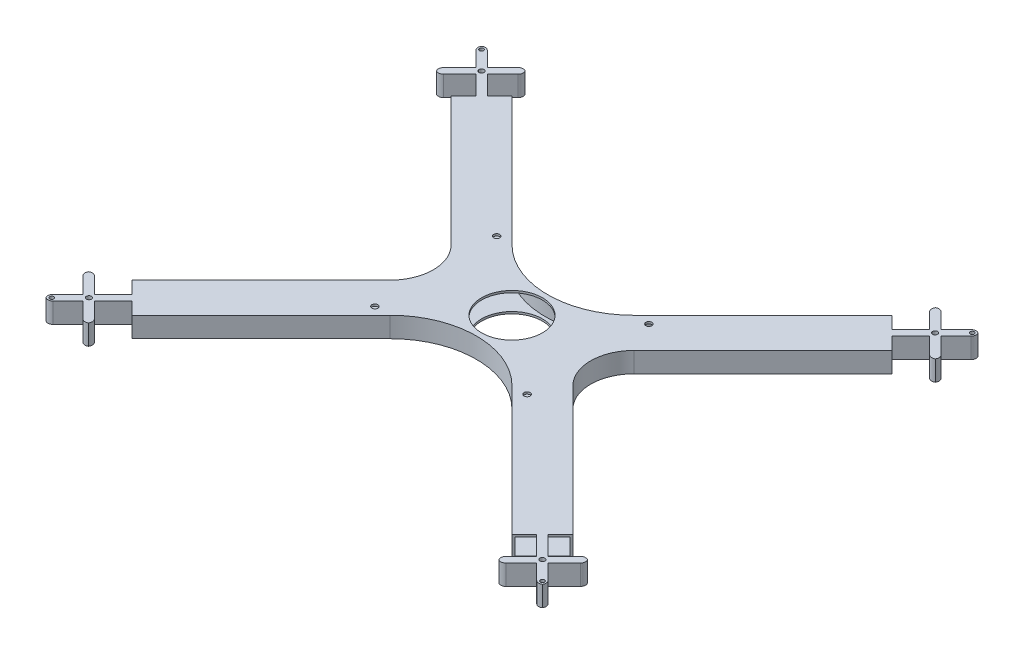
from build123d import *

# Parameters (mm, degrees)
Y_KSEKLIK_EKSTR_ZYON1_DEPTH = 10
IZIM5_W                     = 42.426406871
IZIM5_H                     = 20
Y_KSEKLIK_EKSTR_ZYON2_DEPTH = 180
AYNALAMA2_COPY_1_SKETCH_W   = 42.426406871
AYNALAMA2_COPY_1_SKETCH_H   = 20
AYNALAMA2_COPY_1_DEPTH      = 180
BO_ALTMA3_T                 = -2
IZIM10_R                    = 30
KES_EKSTR_ZYON4_DEPTH       = 52
IZIM11_R                    = 3
KES_EKSTR_ZYON5_DEPTH       = 52
IZIM12_W                    = 8
IZIM12_H                    = 20
Y_KSEKLIK_EKSTR_ZYON3_DEPTH = 60
IZIM14_W                    = 8
IZIM14_H                    = 20
Y_KSEKLIK_EKSTR_ZYON4_DEPTH = 27.5
IZIM15_R                    = 2.5
KES_EKSTR_ZYON6_DEPTH       = 52
IZIM16_W                    = 8
IZIM16_H                    = 20
Y_KSEKLIK_EKSTR_ZYON5_DEPTH = 7
RADYUS2_R                   = 5
IZIM17_R                    = 2
KES_EKSTR_ZYON7_DEPTH       = 31
RADYUS2_OF_AYNALAMA3_R      = 5
AYNALAMA4_START             = -10
AYNALAMA4_OUTLINE_R         = 2
AYNALAMA4_OUTLINE_R_2       = 2.5
AYNALAMA4_DEPTH             = 20


# Read off the part's stored shape, not the designer's step: Aynalama4
with BuildPart() as part:
    # Çizim1 → Yükseklik-Ekstrüzyon1 (new, symmetric)
    with BuildSketch(Plane(origin=(0, 0, 0), x_dir=(1, 0, 0), z_dir=(0, 1, 0))):
        with BuildLine():
            ThreePointArc((90, 30), (77.573593129, 0), (90, -30))
            Line((90, -30), (60, -60))
            ThreePointArc((60, -60), (0, -35.147186258), (-60, -60))
            Line((-60, -60), (-90, -30))
            ThreePointArc((-90, -30), (-77.573593129, 0), (-90, 30))
            Line((-90, 30), (-60, 60))
            ThreePointArc((-60, 60), (0, 35.147186258), (60, 60))
            Line((60, 60), (90, 30))
        make_face()
    extrude(amount=Y_KSEKLIK_EKSTR_ZYON1_DEPTH, both=True)

    # Çizim5 → Yükseklik-Ekstrüzyon2 (add)
    with BuildSketch(Plane(origin=(60, 0, 60), x_dir=(0.7071067811865477, 0, -0.7071067811865474), z_dir=(0.7071067811865474, 0, 0.7071067811865477))):
        with Locations((21.213203436, 0)):
            Rectangle(IZIM5_W, IZIM5_H)
    y_kseklik_ekstr_zyon2 = extrude(amount=Y_KSEKLIK_EKSTR_ZYON2_DEPTH)

    # Aynalama1: Yükseklik-Ekstrüzyon2 across plane
    add(y_kseklik_ekstr_zyon2.mirror(Plane.XY))

    # Aynalama2: Yükseklik-Ekstrüzyon2 across plane
    add(y_kseklik_ekstr_zyon2.mirror(Plane(origin=(0, 0, 0), x_dir=(0, 0, 1), z_dir=(1, 0, 0))))

    # Aynalama2 copy 1 sketch → Aynalama2 copy 1 (add)
    with BuildSketch(Plane(origin=(-60, 0, -60), x_dir=(-0.7071067811865477, 0, 0.7071067811865474), z_dir=(-0.7071067811865474, 0, -0.7071067811865477))):
        with Locations((21.213203436, 0)):
            Rectangle(AYNALAMA2_COPY_1_SKETCH_W, AYNALAMA2_COPY_1_SKETCH_H)
    extrude(amount=AYNALAMA2_COPY_1_DEPTH)

    # İç Boşaltma3
    bo_altma3_openings = [part.faces().sort_by_distance(p)[0] for p in [
        (202.279220614, 0, 172.279220614),
    ]]
    offset(amount=BO_ALTMA3_T, openings=bo_altma3_openings, kind=Kind.INTERSECTION)

    # Çizim10 → Kes-Ekstrüzyon4 (cut)
    with BuildSketch(Plane(origin=(0, 10, 0), x_dir=(1, 0, 0), z_dir=(0, 1, 0))):
        with Locations(Location((0, 0, 0), (0, 0, 270))):
            Circle(IZIM10_R)
    extrude(amount=-KES_EKSTR_ZYON4_DEPTH, mode=Mode.SUBTRACT)

    # Çizim11 → Kes-Ekstrüzyon5 (cut)
    with BuildSketch(Plane(origin=(0, 10, 0), x_dir=(1, 0, 0), z_dir=(0, 1, 0))):
        with Locations(Location((74.889148593, 60, 0), (0, 0, 270))):
            Circle(IZIM11_R)
        with Locations(Location((74.889148593, -60, 0), (0, 0, 270))):
            Circle(IZIM11_R)
        with Locations(Location((-75.110851407, -60, 0), (0, 0, 270))):
            Circle(IZIM11_R)
        with Locations(Location((-75.110851407, 60, 0), (0, 0, 270))):
            Circle(IZIM11_R)
    extrude(amount=-KES_EKSTR_ZYON5_DEPTH, mode=Mode.SUBTRACT)

    # Çizim12 → Yükseklik-Ekstrüzyon3 (add)
    with BuildSketch(Plane(origin=(187.279220614, 0, -187.279220614), x_dir=(-0.7071067811865477, 0, -0.7071067811865474), z_dir=(0.7071067811865474, 0, -0.7071067811865477))):
        with Locations((-21.213203436, 0)):
            Rectangle(IZIM12_W, IZIM12_H)
    y_kseklik_ekstr_zyon3 = extrude(amount=Y_KSEKLIK_EKSTR_ZYON3_DEPTH)

    # Çizim14 → Yükseklik-Ekstrüzyon4 (add, symmetric)
    with BuildSketch(Plane(origin=(17.828427125, 0, 17.828427125), x_dir=(0.7071067811865475, 0, -0.7071067811865477), z_dir=(0.7071067811865477, 0, 0.7071067811865475))):
        with Locations((295.042813742, 0)):
            Rectangle(IZIM14_W, IZIM14_H)
    y_kseklik_ekstr_zyon4 = extrude(amount=Y_KSEKLIK_EKSTR_ZYON4_DEPTH, both=True)

    # Çizim15 → Kes-Ekstrüzyon6 (cut)
    with BuildSketch(Plane(origin=(0, 10, 0), x_dir=(1, 0, 0), z_dir=(0, 1, 0))):
        with Locations(Location((223.492424049, 193.492424049, 0), (0, 0, 270))):
            Circle(IZIM15_R)
    kes_ekstr_zyon6 = extrude(amount=-KES_EKSTR_ZYON6_DEPTH, mode=Mode.SUBTRACT)

    # Çizim16 → Yükseklik-Ekstrüzyon5 (add)
    with BuildSketch(Plane(origin=(-1.617009358, 0, -1.617009358), x_dir=(-0.7071067811865475, 0, 0.7071067811865477), z_dir=(-0.7071067811865477, 0, -0.7071067811865475))):
        with Locations((-295.042813742, 0)):
            Rectangle(IZIM16_W, IZIM16_H)
    y_kseklik_ekstr_zyon5 = extrude(amount=Y_KSEKLIK_EKSTR_ZYON5_DEPTH)

    # Radyus2
    # the kernel refuses this fillet: 5 mm, written as the material it takes off along each edge
    with BuildSketch(Plane(origin=(243.07221082, -22.5, -168.524483605), x_dir=(-0.7071067811865446, 0, -0.7071067811865503), z_dir=(0, 1, 0)), Plane(origin=(204.888444636, -22.5, -218.021958289), x_dir=(0.7071067811865503, 0, 0.7071067811865446), z_dir=(0, 1, 0)), Plane(origin=(241.87720036, -22.5, -217.53405461), x_dir=(0.7071067811865476, 0, 0.7071067811865476), z_dir=(0, 1, 0))) as radyus2_piece_1:
        with BuildLine():
            CenterArc((RADYUS2_R, -RADYUS2_R), RADYUS2_R, 90, 90)
            Line((0, -RADYUS2_R), (0, 0))
            Line((0, 0), (RADYUS2_R, 0))
        make_face()
    extrude(amount=45, mode=Mode.SUBTRACT)
    with BuildSketch(Plane(origin=(248.72906507, 22.5, -174.181337855), x_dir=(-0.7071067811865476, 0, 0.7071067811865476), z_dir=(0, -1, 0)), Plane(origin=(199.231590387, 22.5, -212.365104039), x_dir=(0.7071067811865476, 0, -0.7071067811865476), z_dir=(0, -1, 0)), Plane(origin=(247.53405461, 22.5, -211.87720036), x_dir=(-0.7071067811865532, 0, 0.7071067811865419), z_dir=(0, -1, 0))) as radyus2_piece_2:
        with BuildLine():
            CenterArc((RADYUS2_R, RADYUS2_R), RADYUS2_R, 180, 90)
            Line((0, RADYUS2_R), (0, 0))
            Line((0, 0), (RADYUS2_R, 0))
        make_face()
    extrude(amount=45, mode=Mode.SUBTRACT)

    # Çizim17 → Kes-Ekstrüzyon7 (cut)
    with BuildSketch(Plane(origin=(0, 10, 0), x_dir=(1, 0, 0), z_dir=(0, 1, 0))):
        with Locations(Location((241.805768069, 211.805768069, 0), (0, 0, 270))):
            Circle(IZIM17_R)
    kes_ekstr_zyon7 = extrude(amount=-KES_EKSTR_ZYON7_DEPTH, mode=Mode.SUBTRACT)

    # Aynalama3: Yükseklik-Ekstrüzyon3, Yükseklik-Ekstrüzyon4, Kes-Ekstrüzyon6, Yükseklik-Ekstrüzyon5, Kes-Ekstrüzyon7 across plane
    add(y_kseklik_ekstr_zyon3.mirror(Plane.XY))
    add(y_kseklik_ekstr_zyon4.mirror(Plane.XY))
    add(kes_ekstr_zyon6.mirror(Plane.XY), mode=Mode.SUBTRACT)
    add(y_kseklik_ekstr_zyon5.mirror(Plane.XY))
    add(kes_ekstr_zyon7.mirror(Plane.XY), mode=Mode.SUBTRACT)

    # Radyus2 of Aynalama3
    # the kernel refuses this fillet: 5 mm, written as the material it takes off along each edge
    with BuildSketch(Plane(origin=(243.07221082, -22.5, 168.524483605), x_dir=(-0.7071067811865503, 0, 0.7071067811865446), z_dir=(0, 1, 0)), Plane(origin=(204.888444636, -22.5, 218.021958289), x_dir=(0.7071067811865446, 0, -0.7071067811865503), z_dir=(0, 1, 0)), Plane(origin=(241.87720036, -22.5, 217.53405461), x_dir=(0.7071067811865475, 0, -0.7071067811865475), z_dir=(0, 1, 0))) as radyus2_of_aynalama3_piece_1:
        with BuildLine():
            CenterArc((RADYUS2_OF_AYNALAMA3_R, RADYUS2_OF_AYNALAMA3_R), RADYUS2_OF_AYNALAMA3_R, 180, 90)
            Line((0, RADYUS2_OF_AYNALAMA3_R), (0, 0))
            Line((0, 0), (RADYUS2_OF_AYNALAMA3_R, 0))
        make_face()
    extrude(amount=45, mode=Mode.SUBTRACT)
    with BuildSketch(Plane(origin=(248.72906507, 22.5, 174.181337855), x_dir=(-0.7071067811865476, 0, -0.7071067811865476), z_dir=(0, -1, 0)), Plane(origin=(199.231590387, 22.5, 212.365104039), x_dir=(0.7071067811865476, 0, 0.7071067811865476), z_dir=(0, -1, 0)), Plane(origin=(247.53405461, 22.5, 211.87720036), x_dir=(-0.7071067811865503, 0, -0.7071067811865447), z_dir=(0, -1, 0))) as radyus2_of_aynalama3_piece_2:
        with BuildLine():
            CenterArc((RADYUS2_OF_AYNALAMA3_R, -RADYUS2_OF_AYNALAMA3_R), RADYUS2_OF_AYNALAMA3_R, 90, 90)
            Line((0, -RADYUS2_OF_AYNALAMA3_R), (0, 0))
            Line((0, 0), (RADYUS2_OF_AYNALAMA3_R, 0))
        make_face()
    extrude(amount=45, mode=Mode.SUBTRACT)

    # Aynalama4 outline → Aynalama4 (add)
    # profile 1 of 2: a face of its own
    with BuildSketch(Plane(origin=(0, 0, 0), x_dir=(1, 0, 0), z_dir=(0, 1, 0)).offset(AYNALAMA4_START)):
        with BuildLine():
            Line((-205.107647738, 169.45079349), (-199.45079349, 175.107647738))
            Line((-199.45079349, 175.107647738), (-217.969920088, 193.626774338))
            Line((-217.969920088, 193.626774338), (-202.767124293, 208.829570133))
            ThreePointArc((-202.767124293, 208.829570133), (-201.327977434, 211.862559229), (-202.131449802, 215.122098873))
            ThreePointArc((-202.131449802, 215.122098873), (-205.390989446, 215.925571242), (-208.423978542, 214.486424383))
            Line((-208.423978542, 214.486424383), (-223.626774338, 199.283628587))
            Line((-223.626774338, 199.283628587), (-238.341666454, 213.998520704))
            ThreePointArc((-238.341666454, 213.998520704), (-241.37465555, 215.437667563), (-244.634195194, 214.634195194))
            ThreePointArc((-244.634195194, 214.634195194), (-245.437667563, 211.37465555), (-243.998520704, 208.341666454))
            Line((-243.998520704, 208.341666454), (-229.283628587, 193.626774338))
            Line((-229.283628587, 193.626774338), (-245.193531164, 177.716871761))
            ThreePointArc((-245.193531164, 177.716871761), (-246.632678023, 174.683882665), (-245.829205654, 171.424343021))
            ThreePointArc((-245.829205654, 171.424343021), (-242.56966601, 170.620870652), (-239.536676914, 172.060017511))
            Line((-239.536676914, 172.060017511), (-223.626774338, 187.969920088))
            Line((-223.626774338, 187.969920088), (-205.107647738, 169.45079349))
        make_face()
        with Locations((-241.805768069, 211.805768069)):
            Circle(AYNALAMA4_OUTLINE_R, mode=Mode.SUBTRACT)
        with Locations((-223.492424049, 193.492424049)):
            Circle(AYNALAMA4_OUTLINE_R_2, mode=Mode.SUBTRACT)
    # profile 2 of 2: a face of its own
    with BuildSketch(Plane(origin=(0, 0, 0), x_dir=(1, 0, 0), z_dir=(0, 1, 0)).offset(AYNALAMA4_START)):
        with BuildLine():
            Line((-217.969920088, -193.626774338), (-199.450793489, -175.107647738))
            Line((-199.450793489, -175.107647738), (-205.107647738, -169.45079349))
            Line((-205.107647738, -169.45079349), (-223.626774338, -187.969920088))
            Line((-223.626774338, -187.969920088), (-239.536676914, -172.060017511))
            ThreePointArc((-239.536676914, -172.060017511), (-242.56966601, -170.620870652), (-245.829205654, -171.424343021))
            ThreePointArc((-245.829205654, -171.424343021), (-246.632678023, -174.683882665), (-245.193531164, -177.716871761))
            Line((-245.193531164, -177.716871761), (-229.283628587, -193.626774338))
            Line((-229.283628587, -193.626774338), (-243.998520704, -208.341666454))
            ThreePointArc((-243.998520704, -208.341666454), (-245.437667563, -211.37465555), (-244.634195194, -214.634195194))
            ThreePointArc((-244.634195194, -214.634195194), (-241.37465555, -215.437667563), (-238.341666454, -213.998520704))
            Line((-238.341666454, -213.998520704), (-223.626774338, -199.283628587))
            Line((-223.626774338, -199.283628587), (-208.423978542, -214.486424383))
            ThreePointArc((-208.423978542, -214.486424383), (-205.390989446, -215.925571242), (-202.131449802, -215.122098873))
            ThreePointArc((-202.131449802, -215.122098873), (-201.327977434, -211.862559229), (-202.767124293, -208.829570133))
            Line((-202.767124293, -208.829570133), (-217.969920088, -193.626774338))
        make_face()
        with Locations((-241.805768069, -211.805768069)):
            Circle(AYNALAMA4_OUTLINE_R, mode=Mode.SUBTRACT)
        with Locations((-223.492424049, -193.492424049)):
            Circle(AYNALAMA4_OUTLINE_R_2, mode=Mode.SUBTRACT)
    extrude(amount=AYNALAMA4_DEPTH)


solid = part.part
